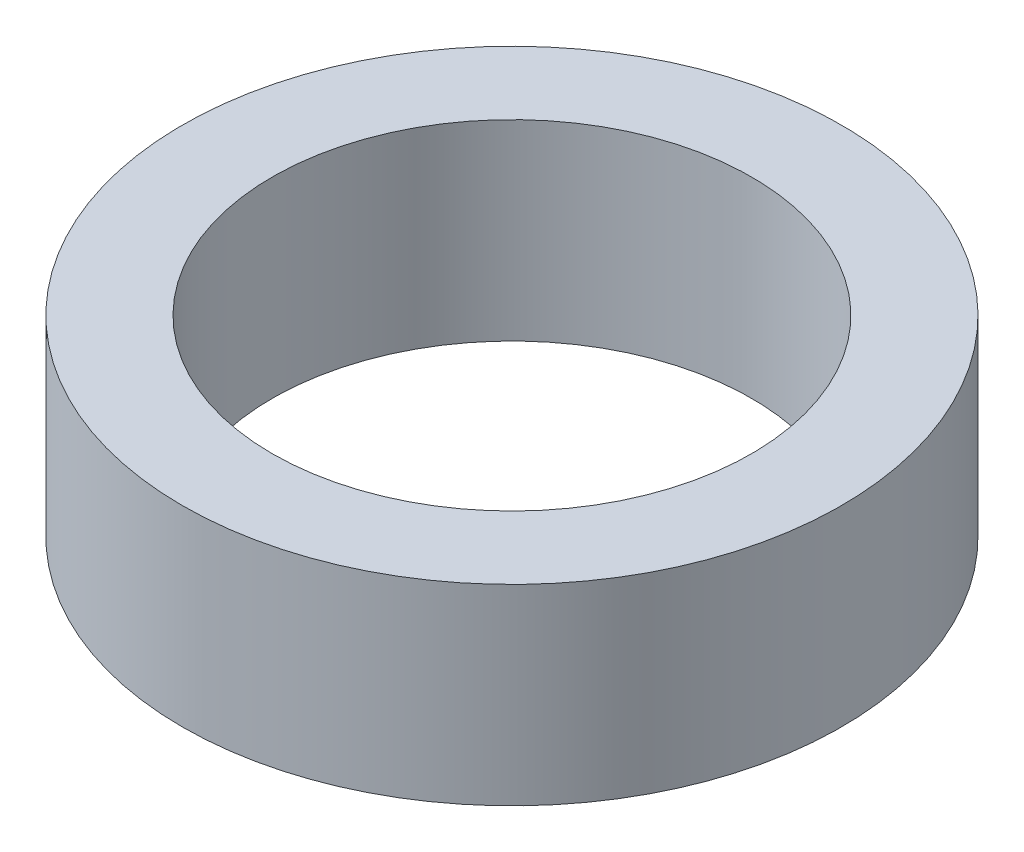
from build123d import *

# Parameters (mm, degrees)
SKETCH1_R           = 27.5
BOSS_EXTRUDE1_DEPTH = 16
SKETCH2_R           = 20
CUT_EXTRUDE1_DEPTH  = 43.053537307


with BuildPart() as part:
    # Sketch1 → Boss-Extrude1 (new body)
    with BuildSketch(Plane(origin=(0, 0, 0), x_dir=(1, 0, 0), z_dir=(0, 1, 0))):
        Circle(SKETCH1_R)
    extrude(amount=BOSS_EXTRUDE1_DEPTH)

    # Sketch2 → Cut-Extrude1 (cut, through all)
    with BuildSketch(Plane(origin=(0, 0, 0), x_dir=(1, 0, 0), z_dir=(0, 1, 0))):
        Circle(SKETCH2_R)
    extrude(amount=CUT_EXTRUDE1_DEPTH, mode=Mode.SUBTRACT)


solid = part.part
